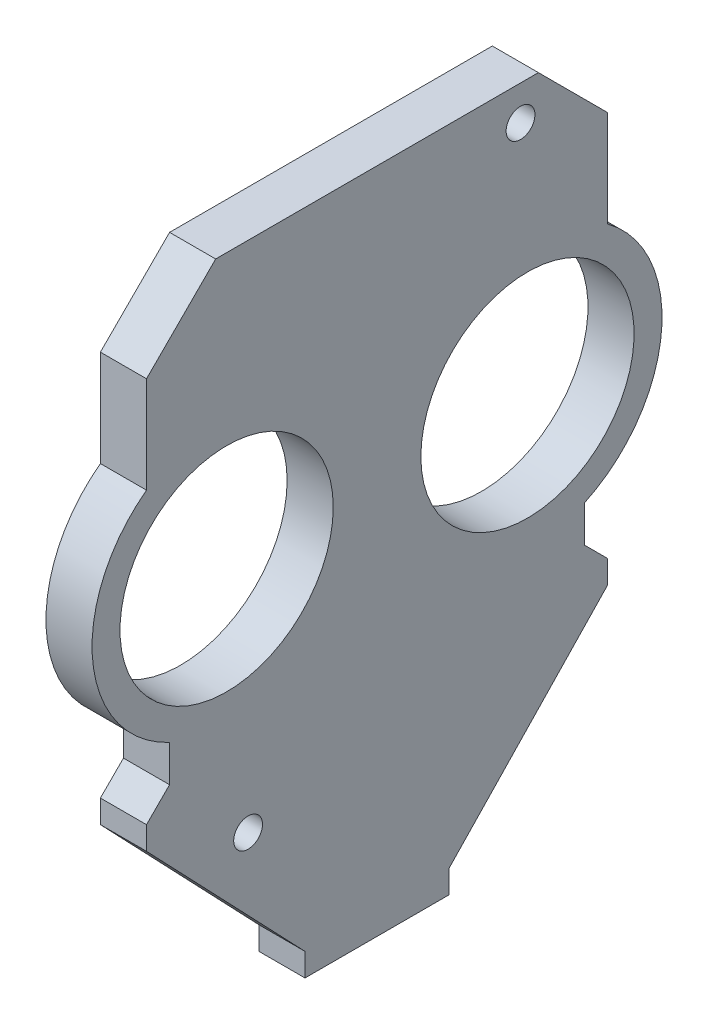
from build123d import *

# Parameters (mm, degrees)
SKETCH1_R           = 2.5
SKETCH1_R_2         = 18.5
BOSS_EXTRUDE1_DEPTH = 8


with BuildPart() as part:
    # Sketch1 → Boss-Extrude1 (new body)
    with BuildSketch(Plane(origin=(0, 0, 0), x_dir=(0, 0, -1), z_dir=(1, 0, 0))):
        with BuildLine():
            Line((-12.5, -64.29), (-40, -35.5))
            Line((-40, -35.5), (-40, -31.5))
            Line((-40, -31.5), (-36, -27.5))
            Line((-36, -27.5), (-36, -21.143055078))
            ThreePointArc((-36, -21.143055078), (-49.329627244, -2.32877567), (-40, 18.757099403))
            Line((-40, 18.757099403), (-40, 35.5))
            Line((-40, 35.5), (-28, 47.5))
            Line((-28, 47.5), (28, 47.5))
            Line((28, 47.5), (40, 35.5))
            Line((40, 35.5), (40, 18.757099403))
            ThreePointArc((40, 18.757099403), (49.329627244, -2.32877567), (36, -21.143055078))
            Line((36, -21.143055078), (36, -27.5))
            Line((36, -27.5), (40, -31.5))
            Line((40, -31.5), (40, -35.5))
            Line((40, -35.5), (12.5, -64.29))
            Line((12.5, -64.29), (12.5, -68.29))
            Line((12.5, -68.29), (-12.5, -68.29))
            Line((-12.5, -68.29), (-12.5, -64.29))
        make_face()
        with Locations((-22.373880505, -41.5)):
            Circle(SKETCH1_R, mode=Mode.SUBTRACT)
        with Locations((24.891578032, 41.5)):
            Circle(SKETCH1_R, mode=Mode.SUBTRACT)
        with Locations((-26.1, 0)):
            Circle(SKETCH1_R_2, mode=Mode.SUBTRACT)
        with Locations((26.1, 0)):
            Circle(SKETCH1_R_2, mode=Mode.SUBTRACT)
    extrude(amount=BOSS_EXTRUDE1_DEPTH)


solid = part.part
